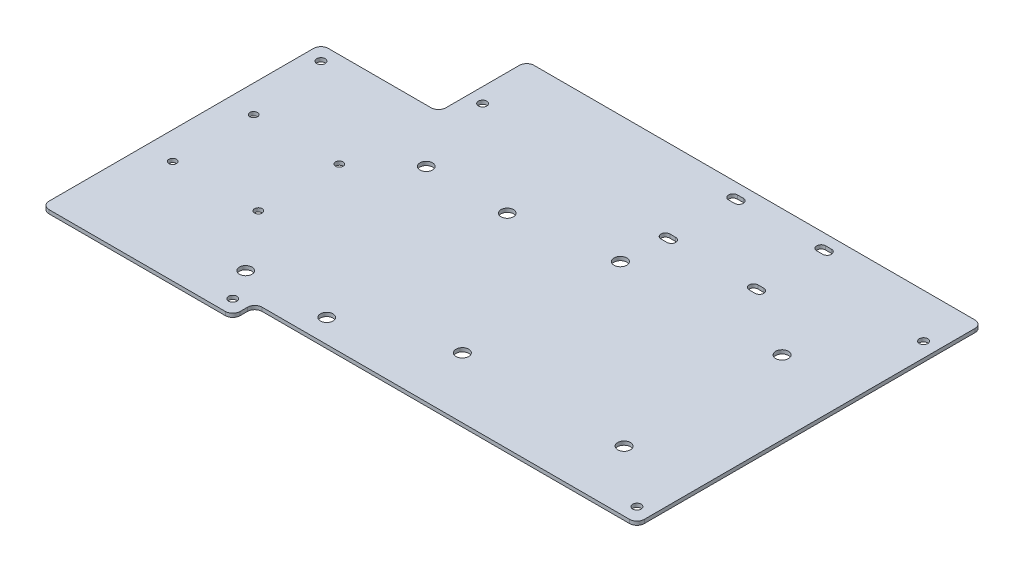
from build123d import *

# Parameters (mm, degrees)
BOSS_EXTRUDE1_DEPTH            = 1.6002
SKETCH3_W                      = 165.1
SKETCH3_H                      = 9.525
CUT_EXTRUDE1_DEPTH             = 295.167716856
FILLET1_R                      = 3.175
FUSE_ZIPTIE_MOUNTS_DEPTH       = 295.167716856
SKETCH5_R                      = 2.75
CONTACTOR_MOUNTING_HOLES_DEPTH = 295.167716856
SKETCH6_R                      = 1.8288
CUT_EXTRUDE2_DEPTH             = 295.167716856
SKETCH7_R                      = 2.7051
CUT_EXTRUDE3_DEPTH             = 295.167716856
SKETCH9_R                      = 1.65
CUT_EXTRUDE4_DEPTH             = 295.167716856


with BuildPart() as part:
    # Sketch1 → Boss-Extrude1 (new body)
    with BuildSketch(Plane(origin=(0, 0, 0), x_dir=(1, 0, 0), z_dir=(0, 1, 0))):
        Polygon((0, 120.65), (0, 0), (247.65, 0), (247.65, 158.75), (50.8, 158.75), (50.8, 120.65), align=None)
    extrude(amount=BOSS_EXTRUDE1_DEPTH)

    # Sketch3 → Cut-Extrude1 (cut, through all)
    with BuildSketch(Plane(origin=(0, 1.6002, 0), x_dir=(1, 0, 0), z_dir=(0, 1, 0))):
        with Locations((165.1, 4.7625)):
            Rectangle(SKETCH3_W, SKETCH3_H)
    extrude(amount=-CUT_EXTRUDE1_DEPTH, mode=Mode.SUBTRACT)

    # Fillet1
    fillet1_edges = [part.edges().sort_by_distance(p)[0] for p in [
        (82.55, 0.8001, 0),
        (0, 0.8001, -120.65),
        (50.8, 0.8001, -120.65),
        (50.8, 0.8001, -158.75),
        (247.65, 0.8001, -158.75),
        (247.65, 0.8001, -9.525),
        (82.55, 0.8001, -9.525),
        (0, 0.8001, 0),
    ]]
    fillet(fillet1_edges, radius=FILLET1_R)

    # Sketch4 → Fuse Ziptie Mounts (cut, through all)
    with BuildSketch(Plane(origin=(0, 1.6002, 0), x_dir=(1, 0, 0), z_dir=(0, 1, 0))):
        with BuildLine():
            Line((146.365, 154.225), (148.905, 154.225))
            ThreePointArc((148.905, 154.225), (150.81, 152.32), (148.905, 150.415))
            Line((148.905, 150.415), (146.365, 150.415))
            ThreePointArc((146.365, 150.415), (144.46, 152.32), (146.365, 154.225))
        make_face()
        with BuildLine():
            Line((184.465, 154.225), (187.005, 154.225))
            ThreePointArc((187.005, 154.225), (188.91, 152.32), (187.005, 150.415))
            Line((187.005, 150.415), (184.465, 150.415))
            ThreePointArc((184.465, 150.415), (182.56, 152.32), (184.465, 154.225))
        make_face()
        with BuildLine():
            Line((184.465, 125.015), (187.005, 125.015))
            ThreePointArc((187.005, 125.015), (188.91, 123.11), (187.005, 121.205))
            Line((187.005, 121.205), (184.465, 121.205))
            ThreePointArc((184.465, 121.205), (182.56, 123.11), (184.465, 125.015))
        make_face()
        with BuildLine():
            Line((146.365, 125.015), (148.905, 125.015))
            ThreePointArc((148.905, 125.015), (150.81, 123.11), (148.905, 121.205))
            Line((148.905, 121.205), (146.365, 121.205))
            ThreePointArc((146.365, 121.205), (144.46, 123.11), (146.365, 125.015))
        make_face()
    extrude(amount=-FUSE_ZIPTIE_MOUNTS_DEPTH, mode=Mode.SUBTRACT)

    # Sketch5 → Contactor Mounting Holes (cut, through all)
    with BuildSketch(Plane(origin=(0, 1.6002, 0), x_dir=(1, 0, 0), z_dir=(0, 1, 0))):
        with Locations((146.05, 103.9876)):
            Circle(SKETCH5_R)
        with Locations((146.05, 35.7124)):
            Circle(SKETCH5_R)
        with Locations((215.9, 103.9876)):
            Circle(SKETCH5_R)
        with Locations((215.9, 35.7124)):
            Circle(SKETCH5_R)
    extrude(amount=-CONTACTOR_MOUNTING_HOLES_DEPTH, mode=Mode.SUBTRACT)

    # Sketch6 → Cut-Extrude2 (cut, through all)
    with BuildSketch(Plane(origin=(0, 1.6002, 0), x_dir=(1, 0, 0), z_dir=(0, 1, 0))):
        with Locations((6.35, 114.3)):
            Circle(SKETCH6_R)
        with Locations((76.2, 6.35)):
            Circle(SKETCH6_R)
        with Locations((241.3, 15.875)):
            Circle(SKETCH6_R)
        with Locations((241.3, 139.7)):
            Circle(SKETCH6_R)
        with Locations((57.15, 133.35)):
            Circle(SKETCH6_R)
    extrude(amount=-CUT_EXTRUDE2_DEPTH, mode=Mode.SUBTRACT)

    # Sketch7 → Cut-Extrude3 (cut, through all)
    with BuildSketch(Plane(origin=(0, 1.6002, 0), x_dir=(1, 0, 0), z_dir=(0, 1, 0))):
        with Locations((103.499998364, 19.649998364)):
            Circle(SKETCH7_R)
        with Locations((68.499998364, 19.649998364)):
            Circle(SKETCH7_R)
        with Locations((103.499998364, 97.649998364)):
            Circle(SKETCH7_R)
        with Locations((68.499998364, 97.649998364)):
            Circle(SKETCH7_R)
    extrude(amount=-CUT_EXTRUDE3_DEPTH, mode=Mode.SUBTRACT)

    # Sketch9 → Cut-Extrude4 (cut, through all)
    with BuildSketch(Plane(origin=(0, 1.6002, 0), x_dir=(1, 0, 0), z_dir=(0, 1, 0))):
        with Locations((11.85, 79.75)):
            Circle(SKETCH9_R)
        with Locations((11.85, 44.75)):
            Circle(SKETCH9_R)
        with Locations((48.85, 79.75)):
            Circle(SKETCH9_R)
        with Locations((48.85, 44.75)):
            Circle(SKETCH9_R)
    extrude(amount=-CUT_EXTRUDE4_DEPTH, mode=Mode.SUBTRACT)


solid = part.part
